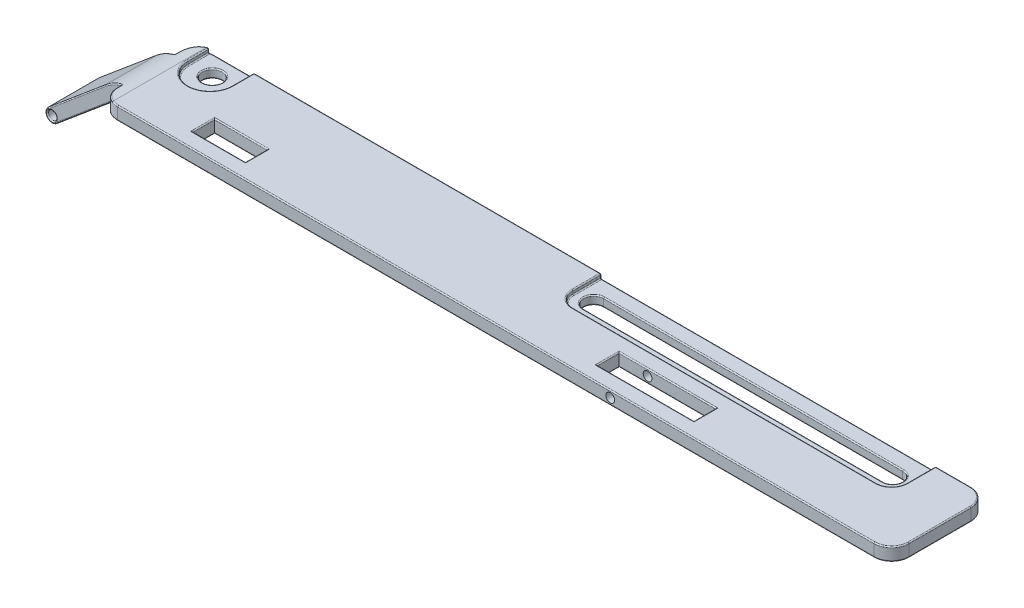
from build123d import *

# Parameters (mm, degrees)
BOSS_EXTRUDE1_DEPTH                    = 11
BOSS_EXTRUDE1_DEPTH_BACK               = 11
SKETCH1_R                              = 1
SKETCH2_W                              = 30.149933191
SKETCH2_H                              = 27.250901153
CUT_EXTRUDE1_DEPTH                     = 5
SKETCH3_W                              = 71.820543682
SKETCH3_H                              = 83.600632857
CUT_EXTRUDE2_DEPTH                     = 5
CUT_EXTRUDE3_REACH                     = 200.411
SKETCH4_W                              = 12
SKETCH4_H                              = 5
SKETCH4_W_2                            = 22
CUT_EXTRUDE4_DEPTH                     = 1
CUT_EXTRUDE5_REACH                     = 200.411
SKETCH6_R                              = 2.25
FILLET1_R                              = 4
FILLET2_R                              = 0.25
F_1_16_0_07874016_DIAMETER_HOLE1_D     = 2.000000064
F_1_16_0_07874016_DIAMETER_HOLE1_DEPTH = 11.399139362
F_1_16_0_07874016_DIAMETER_HOLE1_TIP   = 0.600860638


with BuildPart() as part:
    # Sketch1 → Boss-Extrude1 (new, two sides: drawn at the far end of the back side and taken through both)
    with BuildSketch(Plane.XY.offset(-BOSS_EXTRUDE1_DEPTH_BACK)):
        with BuildLine():
            Line((-182.788173754, -2.339555569), (-195, -12.586494468))
            ThreePointArc((-195, -12.586494468), (-197.113248079, -12.401609218), (-196.928362829, -10.288361138))
            Line((-196.928362829, -10.288361138), (-183.880084457, 0.660444431))
            ThreePointArc((-183.880084457, 0.660444431), (-180.872409793, 2.396926208), (-177.45220836, 3))
            Line((-177.45220836, 3), (0, 3))
            Line((0, 3), (0, 0))
            Line((0, 0), (-176.360297657, 0))
            ThreePointArc((-176.360297657, 0), (-179.780499091, -0.603073792), (-182.788173754, -2.339555569))
        make_face()
        with Locations((-195.964181415, -11.437427803)):
            Circle(SKETCH1_R, mode=Mode.SUBTRACT)
    extrude(amount=BOSS_EXTRUDE1_DEPTH + BOSS_EXTRUDE1_DEPTH_BACK)

    # Sketch2 → Cut-Extrude1 (cut)
    with BuildSketch(Plane.XY.offset(11)):
        with Locations((-195.074966596, -3.959703737)):
            Rectangle(SKETCH2_W, SKETCH2_H)
    extrude(amount=-CUT_EXTRUDE1_DEPTH, mode=Mode.SUBTRACT)

    # Sketch3 → Cut-Extrude2 (cut)
    with BuildSketch(Plane(origin=(0, 0, -11), x_dir=(-1, 0, 0), z_dir=(0, 0, -1))):
        with Locations((215.910271841, -13.071084551)):
            Rectangle(SKETCH3_W, SKETCH3_H)
    extrude(amount=-CUT_EXTRUDE2_DEPTH, mode=Mode.SUBTRACT)

    # Sketch4 → Cut-Extrude3 (cut, up to next)
    with BuildSketch(Plane(origin=(0, 3, 0), x_dir=(1, 0, 0), z_dir=(0, 1, 0)), mode=Mode.PRIVATE) as cut_extrude3_sk1:
        with Locations((-156.45220836, -5)):
            Rectangle(SKETCH4_W, SKETCH4_H)
    cut_extrude3_tool1 = extrude(cut_extrude3_sk1.sketch, amount=-CUT_EXTRUDE3_REACH, mode=Mode.PRIVATE) & part.part
    # Sketch4 → Cut-Extrude3 (cut, up to next)
    with BuildSketch(Plane(origin=(0, 3, 0), x_dir=(1, 0, 0), z_dir=(0, 1, 0)), mode=Mode.PRIVATE) as cut_extrude3_sk2:
        with Locations((-59.45220836, -5)):
            Rectangle(SKETCH4_W_2, SKETCH4_H)
    cut_extrude3_tool2 = extrude(cut_extrude3_sk2.sketch, amount=-CUT_EXTRUDE3_REACH, mode=Mode.PRIVATE) & part.part
    add(cut_extrude3_tool1.solids().sort_by_distance((-156.452208, 3, 5))[0], mode=Mode.SUBTRACT)
    add(cut_extrude3_tool2.solids().sort_by_distance((-59.452208, 3, 5))[0], mode=Mode.SUBTRACT)

    # Sketch5 → Cut-Extrude4 (cut)
    with BuildSketch(Plane(origin=(0, 3, 0), x_dir=(1, 0, 0), z_dir=(0, 1, 0))):
        with BuildLine():
            Line((-88, 11), (-12, 11))
            Line((-12, 11), (-12, 4.5))
            ThreePointArc((-12, 4.5), (-13.025126266, 2.025126266), (-15.5, 1))
            Line((-15.5, 1), (-84.5, 1))
            ThreePointArc((-84.5, 1), (-86.974873734, 2.025126266), (-88, 4.5))
            Line((-88, 4.5), (-88, 11))
        make_face()
        with BuildLine():
            Line((-177, 6), (-177, 11))
            Line((-177, 11), (-167, 11))
            Line((-167, 11), (-167, 6))
            ThreePointArc((-167, 6), (-172, 1), (-177, 6))
        make_face()
    extrude(amount=-CUT_EXTRUDE4_DEPTH, mode=Mode.SUBTRACT)

    # Sketch6 → Cut-Extrude5 (cut, up to next)
    with BuildSketch(Plane(origin=(0, 3, 0), x_dir=(1, 0, 0), z_dir=(0, 1, 0)), mode=Mode.PRIVATE) as cut_extrude5_sk1:
        with Locations(Location((-172, 6.5, 0), (0, 0, 180))):
            Circle(SKETCH6_R)
    cut_extrude5_tool1 = extrude(cut_extrude5_sk1.sketch, amount=-CUT_EXTRUDE5_REACH, mode=Mode.PRIVATE) & part.part
    # Sketch6 → Cut-Extrude5 (cut, up to next)
    with BuildSketch(Plane(origin=(0, 3, 0), x_dir=(1, 0, 0), z_dir=(0, 1, 0)), mode=Mode.PRIVATE) as cut_extrude5_sk2:
        with BuildLine():
            Line((-84, 7.5), (-16, 7.5))
            ThreePointArc((-16, 7.5), (-13.75, 5.25), (-16, 3))
            Line((-16, 3), (-84, 3))
            ThreePointArc((-84, 3), (-86.25, 5.25), (-84, 7.5))
        make_face()
    cut_extrude5_tool2 = extrude(cut_extrude5_sk2.sketch, amount=-CUT_EXTRUDE5_REACH, mode=Mode.PRIVATE) & part.part
    add(cut_extrude5_tool1.solids().sort_by_distance((-172, 3, -6.5))[0], mode=Mode.SUBTRACT)
    add(cut_extrude5_tool2.solids().sort_by_distance((-50, 3, -5.25))[0], mode=Mode.SUBTRACT)

    # Fillet1
    fillet1_edges = [part.edges().sort_by_distance(p)[0] for p in [
        (-180, 0.992049223, 11),
        (-180, 0.992049223, -11),
        (0, 1.5, 11),
        (0, 1.5, -11),
    ]]
    fillet(fillet1_edges, radius=FILLET1_R)

    # Fillet2
    fillet2_edges = [part.edges().sort_by_distance(p)[0] for p in [
        (-162.45220836, 0, 5),
        (-156.45220836, 0, 2.5),
        (-150.45220836, 0, 5),
        (-156.45220836, 0, 7.5),
        (-162.45220836, 3, 5),
        (-156.45220836, 3, 7.5),
        (-150.45220836, 3, 5),
        (-156.45220836, 3, 2.5),
        (-70.45220836, 0, 5),
        (-59.45220836, 0, 2.5),
        (-48.45220836, 0, 5),
        (-59.45220836, 0, 7.5),
        (-70.45220836, 3, 5),
        (-59.45220836, 3, 7.5),
        (-48.45220836, 3, 5),
        (-59.45220836, 3, 2.5),
        (-127.5, 3, -11),
        (-88, 2, -7.75),
        (-50, 2, -11),
        (-88, 2.5, -11),
        (-12, 2, -7.75),
        (-12, 2.5, -11),
        (-13.025126266, 2, -2.025126266),
        (-50, 2, -1),
        (-86.974873734, 2, -2.025126266),
        (-88, 3, -7.75),
        (-86.974873734, 3, -2.025126266),
        (-50, 3, -1),
        (-13.025126266, 3, -2.025126266),
        (-12, 3, -7.75),
        (-172, 2, -1),
        (-171.5, 2, -11),
        (-167, 2, -8.5),
        (-167, 2.5, -11),
        (-172, 3, -1),
        (-167, 3, -8.5),
        (-50, 2, -7.5),
        (-86.25, 2, -5.25),
        (-50, 2, -3),
        (-13.75, 2, -5.25),
        (-86.25, 0, -5.25),
        (-50, 0, -7.5),
        (-13.75, 0, -5.25),
        (-50, 0, -3),
        (-169.75, 0, -6.5),
        (-169.75, 2, -6.5),
        (-180, 2.669992645, 6.5),
        (-179.394637624, 2.809534579, -9.115758844),
        (-179.39451804, 2.809558256, 9.115950694),
        (-177, 3, -8.436491673),
        (-90, 3, 11),
        (0, 3, 0),
        (-8, 3, -11),
        (-1.171572875, 3, -9.828427125),
        (-1.171572875, 3, 9.828427125),
        (-177.228272667, 3, -10.806750091),
        (-176.738816109, 3, 10.931176765),
        (-90, 0, 11),
        (0, 0, 0),
        (-90, 0, -11),
        (-1.171572875, 0, -9.828427125),
        (-1.171572875, 0, 9.828427125),
        (-176.180332183, 0, -10.99593297),
        (-176.180332183, 0, 10.99593297),
        (-180, -0.6858942, -6.5),
        (-179.130203098, -0.391273546, -9.490347117),
        (-179.130203144, -0.391273559, 9.490347059),
        (-177, 2, -8.436491673),
        (-176.50401717, 2, -10.968118785),
        (-177, 2.5, -10.872983346),
        (-181.461540926, -1.39899325, 6),
        (-188.894086877, -7.463025018, 6),
        (-197.113248079, -12.401609218, 6),
        (-190.404223643, -4.813958354, 6),
        (-182.051145611, 1.879739645, 6),
        (-180, -0.6858942, 6.5),
        (-180, 0.992049223, 6),
        (-196.964181415, -11.437427803, 6),
        (-182.051145611, 1.879739645, -6),
        (-188.894086877, -7.463025018, -6),
        (-181.461540926, -1.39899325, -6),
        (-190.404223643, -4.813958354, -6),
        (-197.113248079, -12.401609218, -6),
        (-180, 2.669992645, -6.5),
        (-180, 0.992049223, -6),
        (-196.964181415, -11.437427803, -6),
    ]]
    fillet(fillet2_edges, radius=FILLET2_R - 0.0001)  # a hair under: the kernel refuses the full size

    # 1/16 (0.07874016) Diameter Hole1
    with Locations(Plane.XY.offset(11)):
        with Locations((-64, 1.5)):
            Hole(F_1_16_0_07874016_DIAMETER_HOLE1_D / 2, depth=F_1_16_0_07874016_DIAMETER_HOLE1_DEPTH)
            with Locations((0, 0, -(F_1_16_0_07874016_DIAMETER_HOLE1_DEPTH + F_1_16_0_07874016_DIAMETER_HOLE1_TIP / 2))):  # 118° drill point
                Cone(0, F_1_16_0_07874016_DIAMETER_HOLE1_D / 2, F_1_16_0_07874016_DIAMETER_HOLE1_TIP, mode=Mode.SUBTRACT)


solid = part.part
